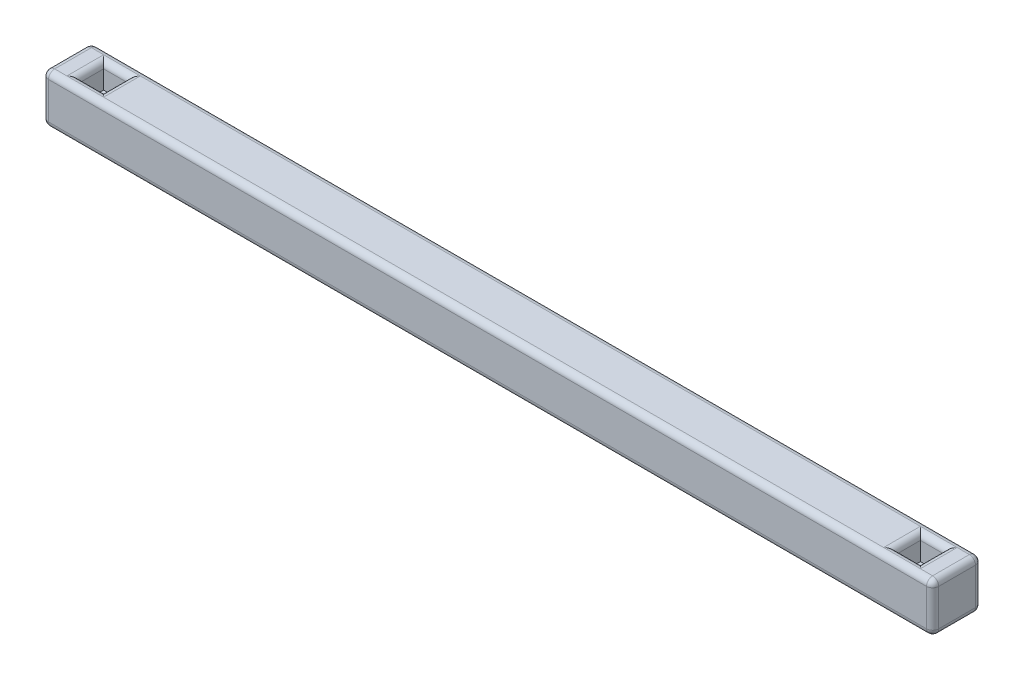
from build123d import *

# Parameters (mm, degrees)
SKETCH1_W           = 230.8225
SKETCH1_H           = 12.7
BOSS_EXTRUDE1_DEPTH = 12.7
SKETCH2_W           = 6.35
SKETCH2_H           = 6.35
CUT_EXTRUDE1_DEPTH  = 6.35
FILLET1_R           = 1.5875


with BuildPart() as part:
    # Sketch1 → Boss-Extrude1 (new body)
    with BuildSketch(Plane(origin=(0, 0, 0), x_dir=(1, 0, 0), z_dir=(0, 1, 0))):
        with Locations((115.41125, 6.35)):
            Rectangle(SKETCH1_W, SKETCH1_H)
    extrude(amount=BOSS_EXTRUDE1_DEPTH)

    # Sketch2 → Cut-Extrude1 (cut)
    with BuildSketch(Plane(origin=(0, 12.7, 0), x_dir=(1, 0, 0), z_dir=(0, 1, 0))):
        with Locations((221.2975, 6.35)):
            Rectangle(SKETCH2_W, SKETCH2_H)
        with Locations((9.525, 6.35)):
            Rectangle(SKETCH2_W, SKETCH2_H)
    extrude(amount=-CUT_EXTRUDE1_DEPTH, mode=Mode.SUBTRACT)

    # Fillet1
    fillet1_edges = [part.edges().sort_by_distance(p)[0] for p in [
        (230.8225, 12.7, -6.35),
        (115.41125, 12.7, 0),
        (218.1225, 12.7, -6.35),
        (221.2975, 12.7, -3.175),
        (224.4725, 12.7, -6.35),
        (221.2975, 12.7, -9.525),
        (12.7, 12.7, -6.35),
        (9.525, 12.7, -9.525),
        (6.35, 12.7, -6.35),
        (9.525, 12.7, -3.175),
        (0, 12.7, -6.35),
        (115.41125, 0, 0),
        (230.8225, 0, -6.35),
        (115.41125, 0, -12.7),
        (0, 0, -6.35),
        (0, 6.35, 0),
        (230.8225, 6.35, 0),
        (230.8225, 6.35, -12.7),
        (0, 6.35, -12.7),
        (115.41125, 12.7, -12.7),
    ]]
    fillet(fillet1_edges, radius=FILLET1_R - 0.0001)  # a hair under: the kernel refuses the full size


solid = part.part
